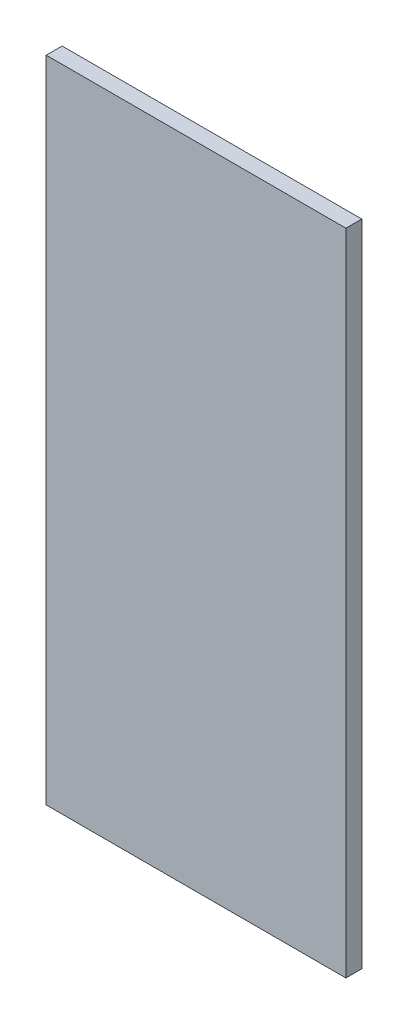
from build123d import *

# Parameters (mm, degrees)
SKETCH1_W          = 60
SKETCH1_H          = 130
BASE_FLANGE1_DEPTH = 3.175


# Sheet-metal steps are written as plain solids
with BuildPart() as part:
    # Sketch1 → Base-Flange1 (new body)
    with BuildSketch(Plane.XY):
        Rectangle(SKETCH1_W, SKETCH1_H)
    extrude(amount=-BASE_FLANGE1_DEPTH)


solid = part.part
